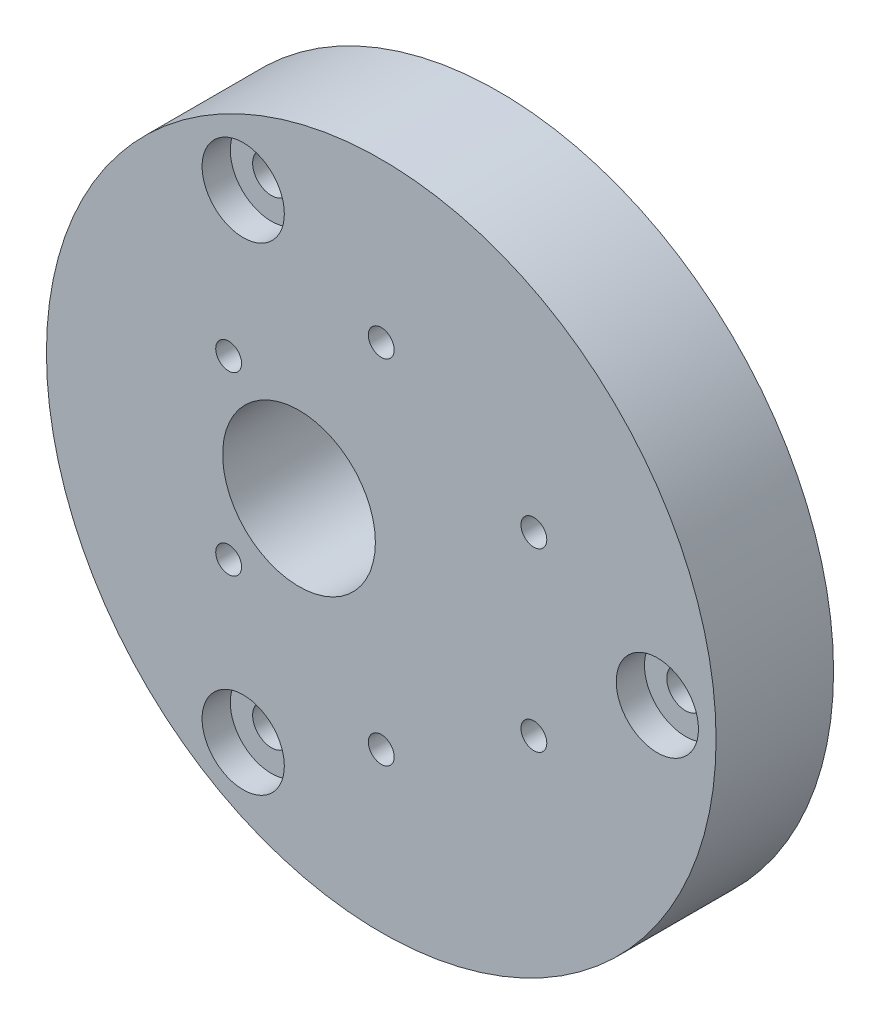
from build123d import *

# Parameters (mm, degrees)
CROQUIS1_R              = 28.5
CROQUIS1_R_2            = 6.5
SALIENTE_EXTRUIR1_DEPTH = 10
MATRIZC2_COUNT          = 3
MATRIZC3_COUNT          = 6


with BuildPart() as part:
    # Croquis1 → Saliente-Extruir1 (new body)
    with BuildSketch(Plane.XY):
        Circle(CROQUIS1_R)
        with Locations((-7, 0)):
            Circle(CROQUIS1_R_2, mode=Mode.SUBTRACT)
    extrude(amount=SALIENTE_EXTRUIR1_DEPTH)

    # Croquis4 → Refrentado para tornillo con cabeza tron (revolve, cut)
    with BuildSketch(Plane(origin=(23.5, 0, 10), x_dir=(0, -1, 0), z_dir=(1, 0, 0))):
        Polygon((0, 0), (0, 20.96137699), (1.6, 20), (1.6, 2.4), (3.5, 2.4), (3.5, 0), align=None)
    refrentado_para_tornillo_con_cabeza_tron = revolve(axis=Axis((23.5, 0, 16.35), (0, 0, -1)), mode=Mode.SUBTRACT)

    # MatrizC2: Refrentado para tornillo con cabeza tron ×3 about axis
    matrizc2_axis = Axis((0, 0, 10), (0, 0, -1))
    for i in range(1, MATRIZC2_COUNT):
        add(refrentado_para_tornillo_con_cabeza_tron.rotate(matrizc2_axis, i * 360 / MATRIZC2_COUNT), mode=Mode.SUBTRACT)

    # Croquis9 → Refrentado para tornillo con cabeza  2 (revolve, cut)
    with BuildSketch(Plane(origin=(12.990381057, 7.5, 0), x_dir=(0, 1, 0), z_dir=(1, 0, 0))):
        Polygon((0, 0), (0, 20.660946681), (1.1, 20), (1.1, 1.6), (2.5, 1.6), (2.5, 0), align=None)
    refrentado_para_tornillo_con_cabeza_2 = revolve(axis=Axis((12.990381057, 7.5, -6.35), (0, 0, 1)), mode=Mode.SUBTRACT)

    # MatrizC3: Refrentado para tornillo con cabeza  2 ×6 about axis
    matrizc3_axis = Axis((0, 0, 10), (0, 0, -1))
    for i in range(1, MATRIZC3_COUNT):
        add(refrentado_para_tornillo_con_cabeza_2.rotate(matrizc3_axis, i * 360 / MATRIZC3_COUNT), mode=Mode.SUBTRACT)


solid = part.part
